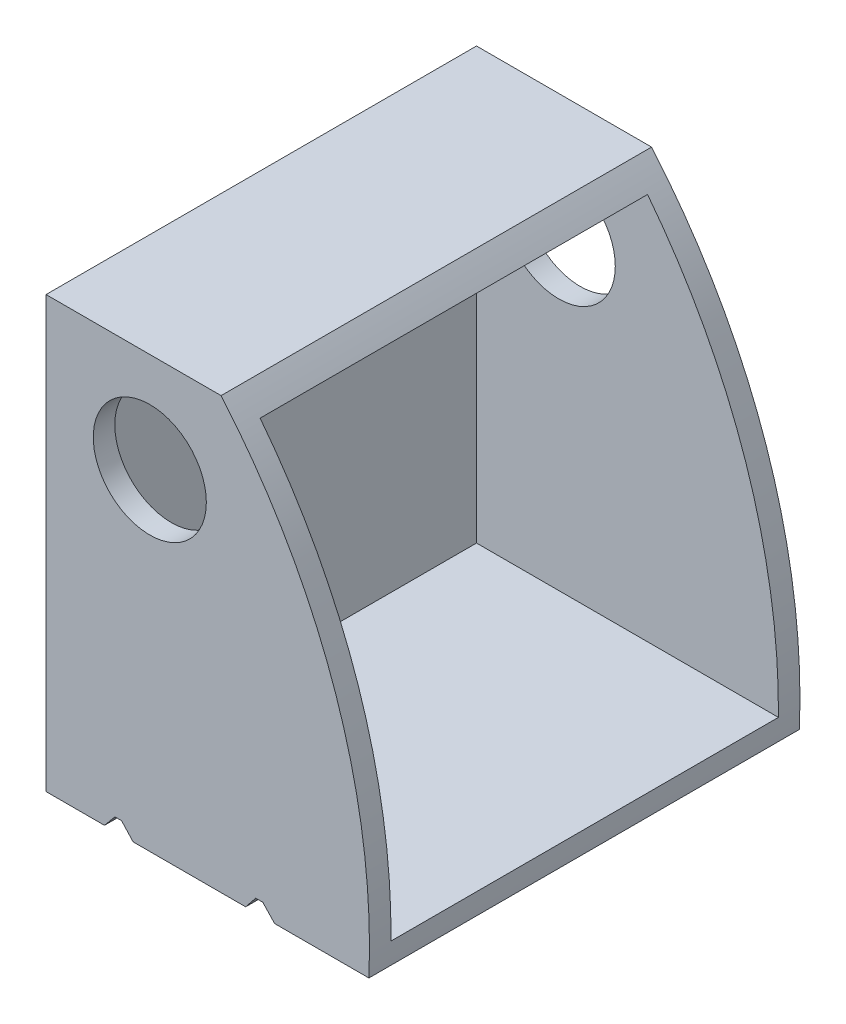
from build123d import *

# Parameters (mm, degrees)
BOSS_EXTRUDE1_DEPTH = 200
SHELL1_T            = -10
SKETCH2_R           = 26.267367073
CUT_EXTRUDE1_DEPTH  = 200
CUT_EXTRUDE2_DEPTH  = 200


with BuildPart() as part:
    # Sketch1 → Boss-Extrude1 (new body)
    with BuildSketch(Plane.XY):
        with BuildLine():
            Line((-10.096774194, 187.410679099), (71.23676642, 187.410679099))
            ThreePointArc((71.23676642, 187.410679099), (124.52196833, 93.917503252), (139.903225806, -12.589320901))
            Line((139.903225806, -12.589320901), (-10.096774194, -12.589320901))
            Line((-10.096774194, -12.589320901), (-10.096774194, 187.410679099))
        make_face()
    extrude(amount=BOSS_EXTRUDE1_DEPTH)

    # Shell1
    shell1_openings = [part.faces().sort_by_distance(p)[0] for p in [
        (124.52196833, 93.917503252, 100),
    ]]
    offset(amount=SHELL1_T, openings=shell1_openings, kind=Kind.INTERSECTION)

    # Sketch2 → Cut-Extrude1 (cut)
    with BuildSketch(Plane.XY.offset(200)):
        with Locations((38.112190517, 141.011879001)):
            Circle(SKETCH2_R)
    extrude(amount=-CUT_EXTRUDE1_DEPTH, mode=Mode.SUBTRACT)

    # Sketch3 → Cut-Extrude2 (cut)
    with BuildSketch(Plane.XY.offset(200)):
        Polygon((17.051493615, -12.589320901), (21.885096182, -6.758256638), (24.992412119, -6.758256638), (30.343900676, -12.589320901), align=None)
        Polygon((82.650385604, -12.589320901), (87.311359509, -6.758256638), (90.591304108, -6.758256638), (96.115421328, -12.589320901), align=None)
    extrude(amount=-CUT_EXTRUDE2_DEPTH, mode=Mode.SUBTRACT)


solid = part.part
